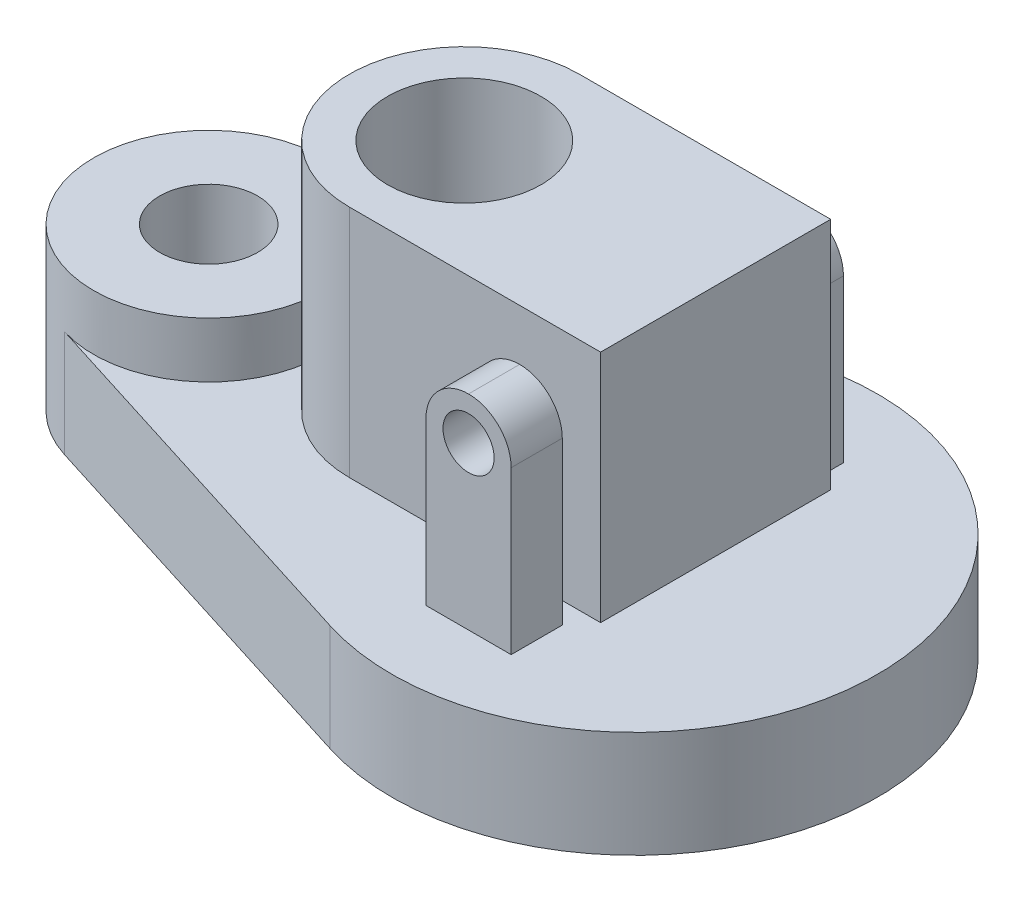
from build123d import *

# Parameters (mm, degrees)
BASE_DEPTH                 = 25
SKETCH2_R                  = 27
SKETCH2_R_2                = 11.5
FRONT_THRU_BORDER_DEPTH    = 13
SKETCH4_R                  = 11.5
FRONT_THRU_HOLE_DEPTH      = 142.431962441
TOP_FEATURE_DEPTH          = 60
SKETCH6_R                  = 18
TOP_FEATURE_HOLE_DEPTH     = 60
SKETCH7_W                  = 90
SKETCH7_H                  = 5
TOP_FEATURE_GAP_DEPTH      = 175.38463235
SKETCH8_W                  = 20
SKETCH8_H                  = 12
TOP_FEATURE_ARM_DEPTH      = 48
FILLET2_R                  = 10
SKETCH10_R                 = 6
TOP_FEATURE_ARM_HOLE_DEPTH = 181.471604415


with BuildPart() as part:
    # Sketch1 → base (new body)
    with BuildSketch(Plane(origin=(0, 0, 0), x_dir=(1, 0, 0), z_dir=(0, 1, 0))):
        with BuildLine():
            Line((-108.1, -25.756358438), (-17.1, -54.374534481))
            ThreePointArc((-17.1, -54.374534481), (57, 0), (-17.1, 54.374534481))
            Line((-17.1, 54.374534481), (-108.1, 25.756358438))
            ThreePointArc((-108.1, 25.756358438), (-127, 0), (-108.1, -25.756358438))
        make_face()
    extrude(amount=BASE_DEPTH)

    # Sketch2 → front thru border (add)
    with BuildSketch(Plane(origin=(0, 25, 0), x_dir=(1, 0, 0), z_dir=(0, 1, 0))):
        with Locations(Location((-100, 0, 0), (0, 0, 107.457603124))):
            Circle(SKETCH2_R)
        with Locations(Location((-100, 0, 0), (0, 0, 90))):
            Circle(SKETCH2_R_2, mode=Mode.SUBTRACT)
    extrude(amount=FRONT_THRU_BORDER_DEPTH)

    # Sketch4 → front thru hole (cut, through all)
    with BuildSketch(Plane(origin=(0, 25, 0), x_dir=(1, 0, 0), z_dir=(0, 1, 0))):
        with Locations(Location((-100, 0, 0), (0, 0, 90))):
            Circle(SKETCH4_R)
    extrude(amount=-FRONT_THRU_HOLE_DEPTH, mode=Mode.SUBTRACT)

    # Sketch5 → top feature (add)
    with BuildSketch(Plane(origin=(0, 25, 0), x_dir=(1, 0, 0), z_dir=(0, 1, 0))):
        with BuildLine():
            Line((0, -27), (-40, -27))
            ThreePointArc((-40, -27), (-67, 0), (-40, 27))
            Line((-40, 27), (0, 27))
            Line((0, 27), (19, 27))
            Line((19, 27), (19, -27))
            Line((19, -27), (0, -27))
        make_face()
    extrude(amount=TOP_FEATURE_DEPTH)

    # Sketch6 → top feature hole (cut)
    with BuildSketch(Plane(origin=(0, 85, 0), x_dir=(1, 0, 0), z_dir=(0, 1, 0))):
        with Locations(Location((-40, 0, 0), (0, 0, 270))):
            Circle(SKETCH6_R)
    extrude(amount=-TOP_FEATURE_HOLE_DEPTH, mode=Mode.SUBTRACT)

    # Sketch7 → top feature gap (cut, through all)
    with BuildSketch(Plane.XY.offset(27)):
        with Locations((-26, 27.5)):
            Rectangle(SKETCH7_W, SKETCH7_H)
    extrude(amount=-TOP_FEATURE_GAP_DEPTH, mode=Mode.SUBTRACT)


with BuildPart() as top_feature_gap_piece_1:
    # of the separate pieces the step leaves, piece 1, a body of its own (top_feature_gap_pieces)
    add(part.part.solids().sort_by_distance((-17.1, 0, -54.374534481))[0])



with BuildPart() as top_feature_gap_piece_2:
    # of the separate pieces the step leaves, piece 2, a body of its own (top_feature_gap_pieces)
    add(part.part.solids().sort_by_distance((19, 30, -27))[0])


with BuildPart() as top_feature_gap_piece_1_1:
    add(top_feature_gap_piece_1.part)

    add(top_feature_gap_piece_2.part)  # top feature arm merges top feature gap piece 2
    # Sketch8 → top feature arm (add)
    with BuildSketch(Plane(origin=(0, 25, 0), x_dir=(1, 0, 0), z_dir=(0, 1, 0))):
        with Locations((0, -33)):
            Rectangle(SKETCH8_W, SKETCH8_H)
        with Locations((0, 33)):
            Rectangle(SKETCH8_W, SKETCH8_H)
    extrude(amount=TOP_FEATURE_ARM_DEPTH)

    # Fillet2
    fillet2_edges = [top_feature_gap_piece_1_1.edges().sort_by_distance(p)[0] for p in [
        (10, 73, -33),
        (-10, 73, -33),
        (10, 73, 33),
        (-10, 73, 33),
    ]]
    fillet(fillet2_edges, radius=FILLET2_R - 0.0001)  # a hair under: the kernel refuses the full size

    # Sketch10 → top feature arm hole (cut, through all)
    with BuildSketch(Plane.XY.offset(39)):
        with Locations((0, 63)):
            Circle(SKETCH10_R)
    extrude(amount=-TOP_FEATURE_ARM_HOLE_DEPTH, mode=Mode.SUBTRACT)


solid = top_feature_gap_piece_1_1.part
